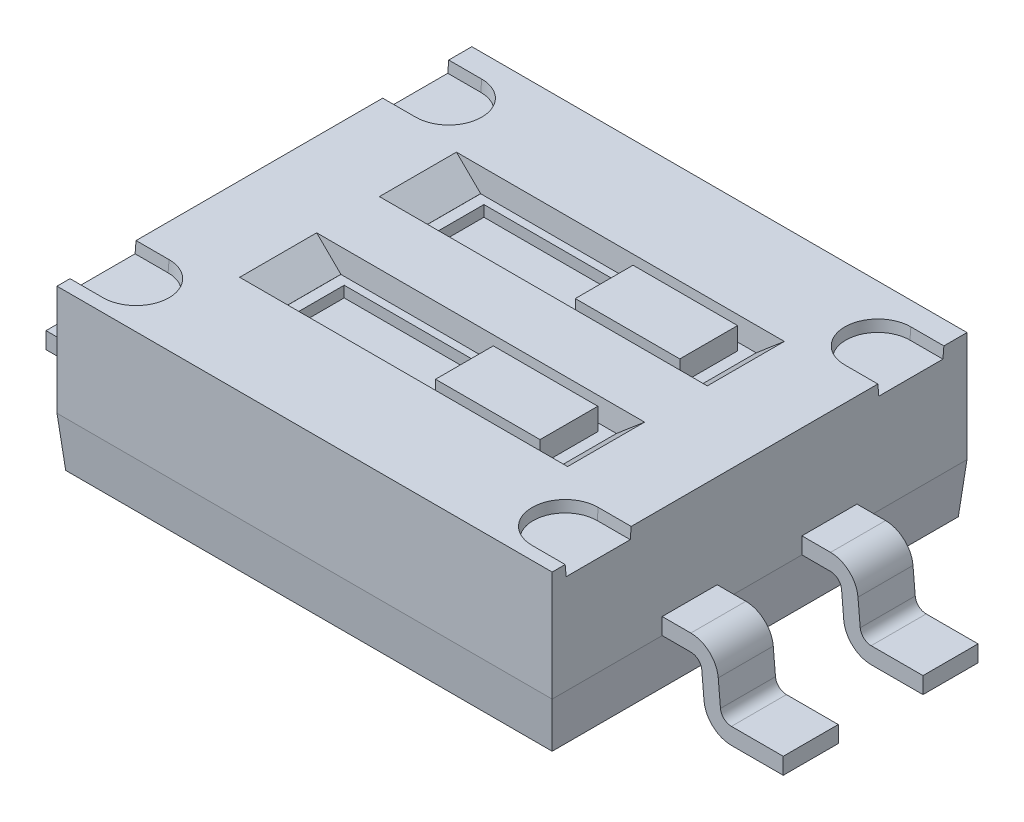
from build123d import *
from OCP.BRepFilletAPI import BRepFilletAPI_MakeChamfer

# Parameters (mm, degrees)
SKETCH1_W                    = 4.5
SKETCH1_H                    = 3.77
EXTRUDE1_DEPTH               = 1
EXTRUDE1_OTHER_WAY_DEPTH     = 0.45
EXTRUDE1_OTHER_WAY_TAPER     = 5
EXTRUDE2_START               = 0.635
EXTRUDE2_DEPTH               = 0.25
FILLET1_R                    = 0.1
FILLET2_R                    = 0.25
CUT_EXTRUDE2_DEPTH           = 0.1
CUT_EXTRUDE2_DRAFT           = -5
CUT_EXTRUDE2_2_DEPTH         = 0.1
CUT_EXTRUDE2_2_DRAFT         = -5
CUT_EXTRUDE2_3_DEPTH         = 0.1
CUT_EXTRUDE2_3_DRAFT         = -5
CUT_EXTRUDE2_4_DEPTH         = 0.1
CUT_EXTRUDE2_4_DRAFT         = -5
CUT_EXTRUDE3_DEPTH           = 0.2
CUT_EXTRUDE3_DRAFT           = -5
CUT_EXTRUDE3_PROFILE_2_DEPTH = 0.2
CUT_EXTRUDE3_PROFILE_2_DRAFT = -5
CHAMFER1_SIZE                = 0.2
CHAMFER1_SIZE2               = 0.220012574
SKETCH5_W                    = 2.305071118
SKETCH5_H                    = 0.525004534
CUT_EXTRUDE4_DEPTH           = 0.1
SKETCH6_W                    = 0.95
SKETCH6_H                    = 0.525004534
EXTRUDE3_DEPTH               = 0.3


# Read off the part's stored shape, not the designer's step: Cut-Extrude2
with BuildPart() as part:
    # Sketch1 → Extrude1 (new body)
    with BuildSketch(Plane(origin=(0, 0, 0), x_dir=(1, 0, 0), z_dir=(0, 1, 0))):
        Rectangle(SKETCH1_W, SKETCH1_H)
    extrude(amount=EXTRUDE1_DEPTH)

    # Sketch1 → Extrude1 other way (add)
    with BuildSketch(Plane(origin=(0, 0, 0), x_dir=(1, 0, 0), z_dir=(0, 1, 0))):
        Rectangle(SKETCH1_W, SKETCH1_H)
    extrude(amount=-EXTRUDE1_OTHER_WAY_DEPTH, taper=EXTRUDE1_OTHER_WAY_TAPER)

    # Sketch2 → Extrude2 (add, symmetric)
    with BuildSketch(Plane.XY.offset(EXTRUDE2_START)):
        Polygon((-0.471718642, 0), (-2.601881235, 0), (-2.65, -0.55), (-3.35, -0.55), (-3.35, -0.4), (-2.787449676, -0.4), (-2.739330911, 0.15), (-0.471718642, 0.15), align=None)
        Polygon((0.471718642, 0.15), (0.471718642, 0), (2.601881235, 0), (2.65, -0.55), (3.35, -0.55), (3.35, -0.4), (2.787449676, -0.4), (2.739330911, 0.15), align=None)
    extrude2 = extrude(amount=EXTRUDE2_DEPTH, both=True)

    # Mirror1: Extrude2 across plane
    add(extrude2.mirror(Plane.XY))

    # Fillet1
    fillet1_edges = [part.edges().sort_by_distance(p)[0] for p in [
        (2.787449676, -0.4, -0.635),
        (2.601881235, 0, -0.635),
        (-2.787449676, -0.4, 0.635),
        (-2.601881235, 0, 0.635),
        (2.601881235, 0, 0.635),
        (2.787449676, -0.4, 0.635),
        (-2.601881235, 0, -0.635),
        (-2.787449676, -0.4, -0.635),
    ]]
    fillet(fillet1_edges, radius=FILLET1_R)

    # Fillet2
    fillet2_edges = [part.edges().sort_by_distance(p)[0] for p in [
        (2.739330911, 0.15, -0.635),
        (2.65, -0.55, -0.635),
        (-2.739330911, 0.15, 0.635),
        (-2.65, -0.55, 0.635),
        (2.739330911, 0.15, 0.635),
        (2.65, -0.55, 0.635),
        (-2.739330911, 0.15, -0.635),
        (-2.65, -0.55, -0.635),
    ]]
    fillet(fillet2_edges, radius=FILLET2_R)


with BuildPart() as cut_extrude2_tool:
    # Cut-Extrude2 outline → Cut-Extrude2 (with draft: the straight prism first)
    with BuildSketch(Plane(origin=(0, 0.9, 0), x_dir=(-1, 0, 0), z_dir=(0, 1, 0))):
        with BuildLine():
            Line((2.25, 1.175438394), (2.25, 1.757940661))
            Line((2.25, 1.757940661), (1.95, 1.757940661))
            ThreePointArc((1.95, 1.757940661), (1.658748866, 1.466689528), (1.95, 1.175438394))
            Line((1.95, 1.175438394), (2.25, 1.175438394))
        make_face()
    extrude(amount=CUT_EXTRUDE2_DEPTH)
    # Cut-Extrude2: the draft: its side faces are tilted about the plane it starts from
    cut_extrude2_sides = [cut_extrude2_tool.faces().sort_by_distance(p)[0] for p in [
        (-2.1, 0.95, 1.175438394),
        (-2.25, 0.95, 1.466689527),
        (-2.1, 0.95, 1.757940661),
        (-1.658748866, 0.95, 1.466689528),
    ]]
    draft(cut_extrude2_sides, Plane(origin=(0, 0.9, 0), x_dir=(-1, 0, 0), z_dir=(0, 1, 0)), CUT_EXTRUDE2_DRAFT)


with BuildPart() as part_1:
    add(part.part)

    # Cut-Extrude2: cut by cut_extrude2_tool
    add(cut_extrude2_tool.part, mode=Mode.SUBTRACT)


with BuildPart() as cut_extrude2_2_tool:
    # Cut-Extrude2 2 outline → Cut-Extrude2 2 (with draft: the straight prism first)
    with BuildSketch(Plane(origin=(0, 0.9, 0), x_dir=(-1, 0, 0), z_dir=(0, 1, 0))):
        with BuildLine():
            Line((2.25, -1.66613077), (2.25, -1.083628503))
            Line((2.25, -1.083628503), (1.95, -1.083628503))
            ThreePointArc((1.95, -1.083628503), (1.658748866, -1.374879636), (1.95, -1.66613077))
            Line((1.95, -1.66613077), (2.25, -1.66613077))
        make_face()
    extrude(amount=CUT_EXTRUDE2_2_DEPTH)
    # Cut-Extrude2 2: the draft: its side faces are tilted about the plane it starts from
    cut_extrude2_2_sides = [cut_extrude2_2_tool.faces().sort_by_distance(p)[0] for p in [
        (-2.25, 0.95, -1.374879637),
        (-2.1, 0.95, -1.083628503),
        (-1.658748866, 0.95, -1.374879637),
        (-2.1, 0.95, -1.66613077),
    ]]
    draft(cut_extrude2_2_sides, Plane(origin=(0, 0.9, 0), x_dir=(-1, 0, 0), z_dir=(0, 1, 0)), CUT_EXTRUDE2_2_DRAFT)


with BuildPart() as part_2:
    add(part_1.part)

    # Cut-Extrude2 2: cut by cut_extrude2_2_tool
    add(cut_extrude2_2_tool.part, mode=Mode.SUBTRACT)


with BuildPart() as cut_extrude2_3_tool:
    # Cut-Extrude2 3 outline → Cut-Extrude2 3 (with draft: the straight prism first)
    with BuildSketch(Plane(origin=(0, 0.9, 0), x_dir=(-1, 0, 0), z_dir=(0, 1, 0))):
        with BuildLine():
            Line((-2.25, -1.083628503), (-2.25, -1.66613077))
            Line((-2.25, -1.66613077), (-1.95, -1.66613077))
            ThreePointArc((-1.95, -1.66613077), (-1.658748866, -1.374879636), (-1.95, -1.083628503))
            Line((-1.95, -1.083628503), (-2.25, -1.083628503))
        make_face()
    extrude(amount=CUT_EXTRUDE2_3_DEPTH)
    # Cut-Extrude2 3: the draft: its side faces are tilted about the plane it starts from
    cut_extrude2_3_sides = [cut_extrude2_3_tool.faces().sort_by_distance(p)[0] for p in [
        (2.25, 0.95, -1.374879637),
        (2.1, 0.95, -1.66613077),
        (1.658748866, 0.95, -1.374879637),
        (2.1, 0.95, -1.083628503),
    ]]
    draft(cut_extrude2_3_sides, Plane(origin=(0, 0.9, 0), x_dir=(-1, 0, 0), z_dir=(0, 1, 0)), CUT_EXTRUDE2_3_DRAFT)


with BuildPart() as part_3:
    add(part_2.part)

    # Cut-Extrude2 3: cut by cut_extrude2_3_tool
    add(cut_extrude2_3_tool.part, mode=Mode.SUBTRACT)


with BuildPart() as cut_extrude2_4_tool:
    # Cut-Extrude2 4 outline → Cut-Extrude2 4 (with draft: the straight prism first)
    with BuildSketch(Plane(origin=(0, 0.9, 0), x_dir=(-1, 0, 0), z_dir=(0, 1, 0))):
        with BuildLine():
            Line((-2.25, 1.757940661), (-2.25, 1.175438394))
            Line((-2.25, 1.175438394), (-1.95, 1.175438394))
            ThreePointArc((-1.95, 1.175438394), (-1.658748866, 1.466689528), (-1.95, 1.757940661))
            Line((-1.95, 1.757940661), (-2.25, 1.757940661))
        make_face()
    extrude(amount=CUT_EXTRUDE2_4_DEPTH)
    # Cut-Extrude2 4: the draft: its side faces are tilted about the plane it starts from
    cut_extrude2_4_sides = [cut_extrude2_4_tool.faces().sort_by_distance(p)[0] for p in [
        (1.658748866, 0.95, 1.466689528),
        (2.1, 0.95, 1.757940661),
        (2.25, 0.95, 1.466689528),
        (2.1, 0.95, 1.175438394),
    ]]
    draft(cut_extrude2_4_sides, Plane(origin=(0, 0.9, 0), x_dir=(-1, 0, 0), z_dir=(0, 1, 0)), CUT_EXTRUDE2_4_DRAFT)


with BuildPart() as part_4:
    add(part_3.part)

    # Cut-Extrude2 4: cut by cut_extrude2_4_tool
    add(cut_extrude2_4_tool.part, mode=Mode.SUBTRACT)


with BuildPart() as cut_extrude3_tool:
    # Sketch4 → Cut-Extrude3 (with draft: the straight prism first)
    with BuildSketch(Plane(origin=(0, 1, 0), x_dir=(-1, 0, 0), z_dir=(0, 1, 0))):
        Polygon((1.27, 0.635), (1.27, 0.985), (-1.27, 0.985), (-1.27, 0.285), (1.27, 0.285), align=None)
    extrude(amount=-CUT_EXTRUDE3_DEPTH)
    # Cut-Extrude3: the draft: its side faces are tilted about the plane it starts from
    cut_extrude3_sides = [cut_extrude3_tool.faces().sort_by_distance(p)[0] for p in [
        (-1.27, 0.9, 0.635),
        (1.27, 0.9, 0.635),
        (0, 0.9, 0.285),
        (0, 0.9, 0.985),
    ]]
    draft(cut_extrude3_sides, Plane(origin=(0, 1, 0), x_dir=(-1, 0, 0), z_dir=(0, 1, 0)), CUT_EXTRUDE3_DRAFT)


with BuildPart() as part_5:
    add(part_4.part)

    # Cut-Extrude3: cut by cut_extrude3_tool
    add(cut_extrude3_tool.part, mode=Mode.SUBTRACT)


with BuildPart() as cut_extrude3_profile_2_tool:
    # Sketch4 → Cut-Extrude3 profile 2 (with draft: the straight prism first)
    with BuildSketch(Plane(origin=(0, 1, 0), x_dir=(-1, 0, 0), z_dir=(0, 1, 0))):
        Polygon((-1.27, -0.985), (1.27, -0.985), (1.27, -0.635), (1.27, -0.285), (-1.27, -0.285), align=None)
    extrude(amount=-CUT_EXTRUDE3_PROFILE_2_DEPTH)
    # Cut-Extrude3 profile 2: the draft: its side faces are tilted about the plane it starts from
    cut_extrude3_profile_2_sides = [cut_extrude3_profile_2_tool.faces().sort_by_distance(p)[0] for p in [
        (0, 0.9, -0.985),
        (0, 0.9, -0.285),
        (-1.27, 0.9, -0.635),
        (1.27, 0.9, -0.635),
    ]]
    draft(cut_extrude3_profile_2_sides, Plane(origin=(0, 1, 0), x_dir=(-1, 0, 0), z_dir=(0, 1, 0)), CUT_EXTRUDE3_PROFILE_2_DRAFT)


with BuildPart() as part_6:
    add(part_5.part)

    # Cut-Extrude3 profile 2: cut by cut_extrude3_profile_2_tool
    add(cut_extrude3_profile_2_tool.part, mode=Mode.SUBTRACT)

    # Chamfer1: one chamfer whose edges measure the first distance from different faces: ONE call of the kernel's chamfer builder (chamfer() names one face for all edges)
    chamfer1_edges_1 = [part_6.edges().sort_by_distance(p)[0] for p in [
        (1.27, 1, -0.635),
    ]]
    chamfer1_side_1 = [part_6.faces().sort_by_distance(p)[0] for p in [
        (1.2613259, 0.900854587, -0.635),
    ]]
    chamfer1_edges_2 = [part_6.edges().sort_by_distance(p)[0] for p in [
        (-1.27, 1, -0.635),
    ]]
    chamfer1_side_2 = [part_6.faces().sort_by_distance(p)[0] for p in [
        (-1.2613259, 0.900854587, -0.635),
    ]]
    chamfer1_edges_3 = [part_6.edges().sort_by_distance(p)[0] for p in [
        (1.27, 1, 0.635),
    ]]
    chamfer1_side_3 = [part_6.faces().sort_by_distance(p)[0] for p in [
        (1.2613259, 0.900854587, 0.635),
    ]]
    chamfer1_edges_4 = [part_6.edges().sort_by_distance(p)[0] for p in [
        (-1.27, 1, 0.635),
    ]]
    chamfer1_side_4 = [part_6.faces().sort_by_distance(p)[0] for p in [
        (-1.2613259, 0.900854587, 0.635),
    ]]
    chamfer1 = BRepFilletAPI_MakeChamfer(part_6.part.solid().wrapped)
    for e in chamfer1_edges_1:
        chamfer1.Add(CHAMFER1_SIZE, CHAMFER1_SIZE2, e.wrapped, chamfer1_side_1[0].wrapped)  # the first distance lies on this face
    for e in chamfer1_edges_2:
        chamfer1.Add(CHAMFER1_SIZE, CHAMFER1_SIZE2, e.wrapped, chamfer1_side_2[0].wrapped)  # the first distance lies on this face
    for e in chamfer1_edges_3:
        chamfer1.Add(CHAMFER1_SIZE, CHAMFER1_SIZE2, e.wrapped, chamfer1_side_3[0].wrapped)  # the first distance lies on this face
    for e in chamfer1_edges_4:
        chamfer1.Add(CHAMFER1_SIZE, CHAMFER1_SIZE2, e.wrapped, chamfer1_side_4[0].wrapped)  # the first distance lies on this face
    add(Compound.cast(chamfer1.Shape()), mode=Mode.REPLACE)

    # Sketch5 → Cut-Extrude4 (cut)
    with BuildSketch(Plane(origin=(0, 0.8, 0), x_dir=(-1, 0, 0), z_dir=(0, 1, 0))):
        with Locations((3.3292e-05, 0.635)):
            Rectangle(SKETCH5_W, SKETCH5_H)
        with Locations((3.3292e-05, -0.635)):
            Rectangle(SKETCH5_W, SKETCH5_H)
    extrude(amount=-CUT_EXTRUDE4_DEPTH, mode=Mode.SUBTRACT)

    # Sketch6 → Extrude3 (add)
    with BuildSketch(Plane(origin=(0, 0.7, 0), x_dir=(-1, 0, 0), z_dir=(0, 1, 0))):
        with Locations((-0.677502267, 0.635)):
            Rectangle(SKETCH6_W, SKETCH6_H)
        with Locations((-0.677502267, -0.635)):
            Rectangle(SKETCH6_W, SKETCH6_H)
    extrude(amount=EXTRUDE3_DEPTH)


solid = part_6.part
